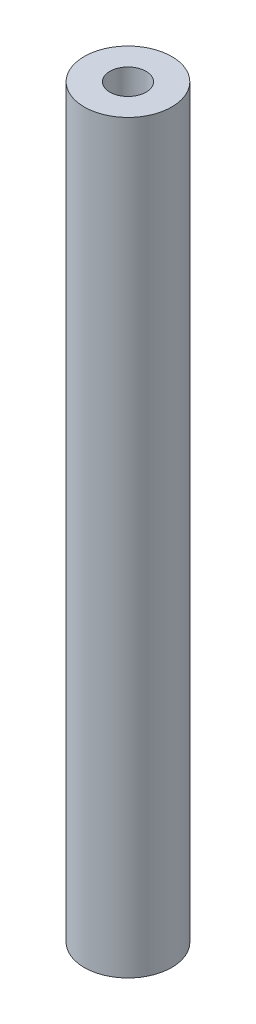
from build123d import *

# Parameters (mm, degrees)
SKETCH1_R           = 2.055
SKETCH1_R_2         = 0.85
BOSS_EXTRUDE1_DEPTH = 17.5


with BuildPart() as part:
    # Sketch1 → Boss-Extrude1 (new, symmetric)
    with BuildSketch(Plane(origin=(0, 0, 0), x_dir=(1, 0, 0), z_dir=(0, 1, 0))):
        Circle(SKETCH1_R)
        Circle(SKETCH1_R_2, mode=Mode.SUBTRACT)
    extrude(amount=BOSS_EXTRUDE1_DEPTH, both=True)


solid = part.part
